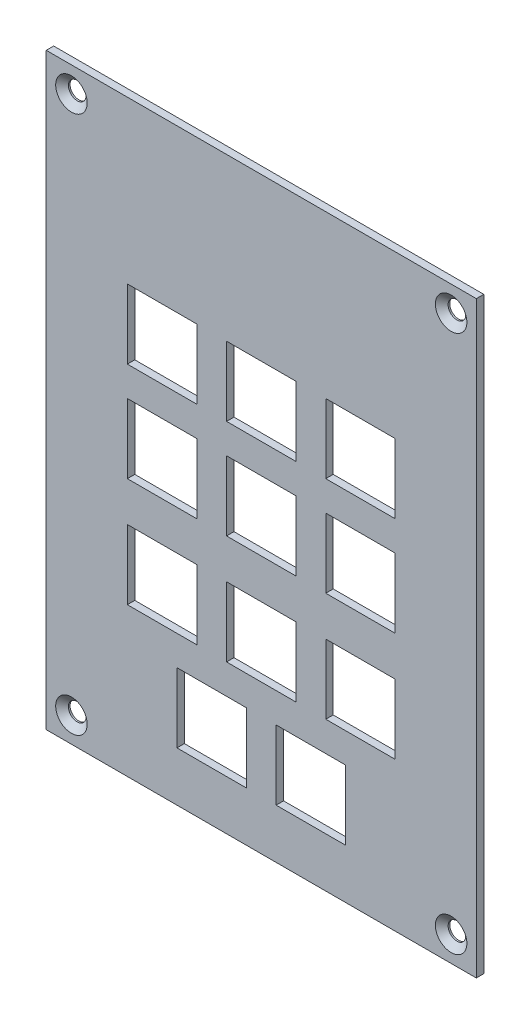
from build123d import *

# Parameters (mm, degrees)
SKETCH1_W           = 86.7
SKETCH1_H           = 118.61
SKETCH1_W_2         = 14
SKETCH1_H_2         = 14
BOSS_EXTRUDE1_DEPTH = 1.5


# Read off the part's stored shape, not the designer's step: CSK for #0 Flat Head Machine Screw (100)1
with BuildPart() as part:
    # Sketch1 → Boss-Extrude1 (new body)
    with BuildSketch(Plane.XY):
        with Locations((-43.35, 59.305)):
            Rectangle(SKETCH1_W, SKETCH1_H)
        with Locations((-23.35, 37)):
            Rectangle(SKETCH1_W_2, SKETCH1_H_2, mode=Mode.SUBTRACT)
        with Locations((-23.35, 79)):
            Rectangle(SKETCH1_W_2, SKETCH1_H_2, mode=Mode.SUBTRACT)
        with Locations((-43.35, 79)):
            Rectangle(SKETCH1_W_2, SKETCH1_H_2, mode=Mode.SUBTRACT)
        with Locations((-63.35, 79)):
            Rectangle(SKETCH1_W_2, SKETCH1_H_2, mode=Mode.SUBTRACT)
        with Locations((-23.35, 59)):
            Rectangle(SKETCH1_W_2, SKETCH1_H_2, mode=Mode.SUBTRACT)
        with Locations((-43.35, 59)):
            Rectangle(SKETCH1_W_2, SKETCH1_H_2, mode=Mode.SUBTRACT)
        with Locations((-63.35, 59)):
            Rectangle(SKETCH1_W_2, SKETCH1_H_2, mode=Mode.SUBTRACT)
        with Locations((-43.35, 37)):
            Rectangle(SKETCH1_W_2, SKETCH1_H_2, mode=Mode.SUBTRACT)
        with Locations((-63.35, 37)):
            Rectangle(SKETCH1_W_2, SKETCH1_H_2, mode=Mode.SUBTRACT)
        with Locations((-33.35, 17)):
            Rectangle(SKETCH1_W_2, SKETCH1_H_2, mode=Mode.SUBTRACT)
        with Locations((-53.35, 17)):
            Rectangle(SKETCH1_W_2, SKETCH1_H_2, mode=Mode.SUBTRACT)
    extrude(amount=BOSS_EXTRUDE1_DEPTH)

    # CSK for _0 Flat Head Machine Screw _ 2 → CSK for #0 Flat Head Machine Screw (100)1 (revolve, cut)
    with BuildSketch(Plane(origin=(-5.08, 5.08, 0), x_dir=(1, 0, 0), z_dir=(0, -1, 0))):
        Polygon((0, 0), (1.778, 0), (1.778, 0.327777815), (3.175, 1.5), (0, 1.5), align=None)
    revolve(axis=Axis((-5.08, 5.08, 0), (0, 0, 1)), mode=Mode.SUBTRACT)

    # CSK for _0 Flat Head Machine Screw _ 3 o → CSK for _0 Flat Head Machine Screw _ 3 (revolve, cut)
    with BuildSketch(Plane(origin=(-81.62, 5.08, 0), x_dir=(1, 0, 0), z_dir=(0, -1, 0))):
        Polygon((0, 0), (1.778, 0), (1.778, 0.327777815), (3.175, 1.5), (0, 1.5), align=None)
    revolve(axis=Axis((-81.62, 5.08, 0), (0, 0, 1)), mode=Mode.SUBTRACT)

    # CSK for _0 Flat Head Machine Screw _ 4 o → CSK for _0 Flat Head Machine Screw _ 4 (revolve, cut)
    with BuildSketch(Plane(origin=(-81.62, 113.53, 0), x_dir=(1, 0, 0), z_dir=(0, -1, 0))):
        Polygon((0, 0), (1.778, 0), (1.778, 0.327777815), (3.175, 1.5), (0, 1.5), align=None)
    revolve(axis=Axis((-81.62, 113.53, 0), (0, 0, 1)), mode=Mode.SUBTRACT)

    # CSK for _0 Flat Head Machine Screw _ 5 o → CSK for _0 Flat Head Machine Screw _ 5 (revolve, cut)
    with BuildSketch(Plane(origin=(-5.08, 113.53, 0), x_dir=(1, 0, 0), z_dir=(0, -1, 0))):
        Polygon((0, 0), (1.778, 0), (1.778, 0.327777815), (3.175, 1.5), (0, 1.5), align=None)
    revolve(axis=Axis((-5.08, 113.53, 0), (0, 0, 1)), mode=Mode.SUBTRACT)


solid = part.part
